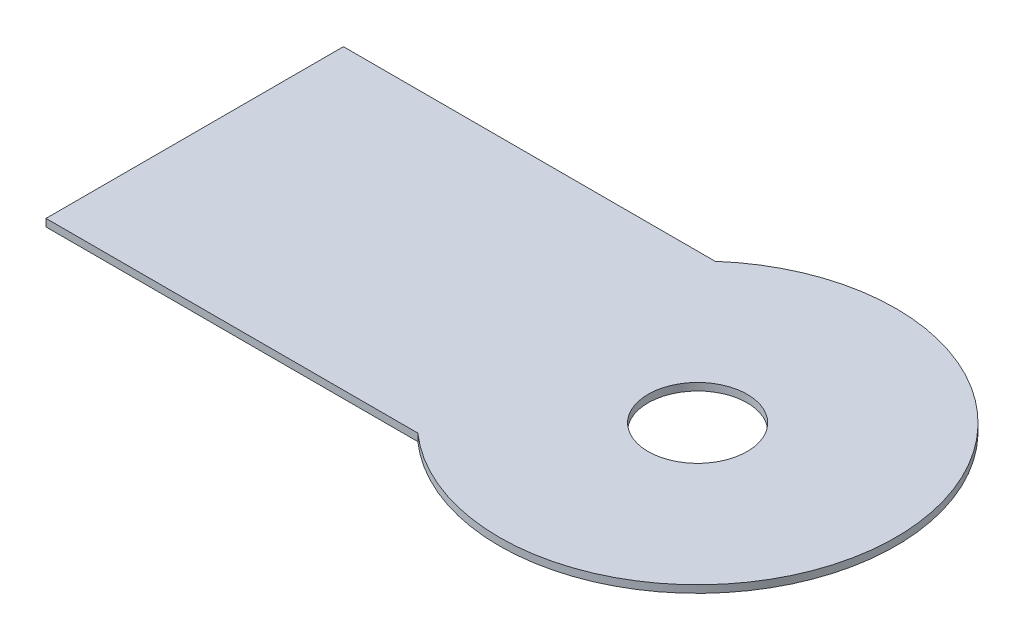
from build123d import *

# Parameters (mm, degrees)
SKETCH1_R          = 20
BASE_FLANGE1_DEPTH = 3


# Sheet-metal steps are written as plain solids
with BuildPart() as part:
    # Sketch1 → Base-Flange1 (new body)
    with BuildSketch(Plane(origin=(0, 0, 0), x_dir=(1, 0, 0), z_dir=(0, 1, 0))):
        with BuildLine():
            Line((0, 0), (150, 0))
            ThreePointArc((150, 0), (282.915026221, 60), (150, 120))
            Line((150, 120), (0, 120))
            Line((0, 120), (0, 0))
        make_face()
        with Locations(Location((202.915026221, 60, 0), (0, 0, 270))):
            Circle(SKETCH1_R, mode=Mode.SUBTRACT)
    extrude(amount=-BASE_FLANGE1_DEPTH)


solid = part.part
